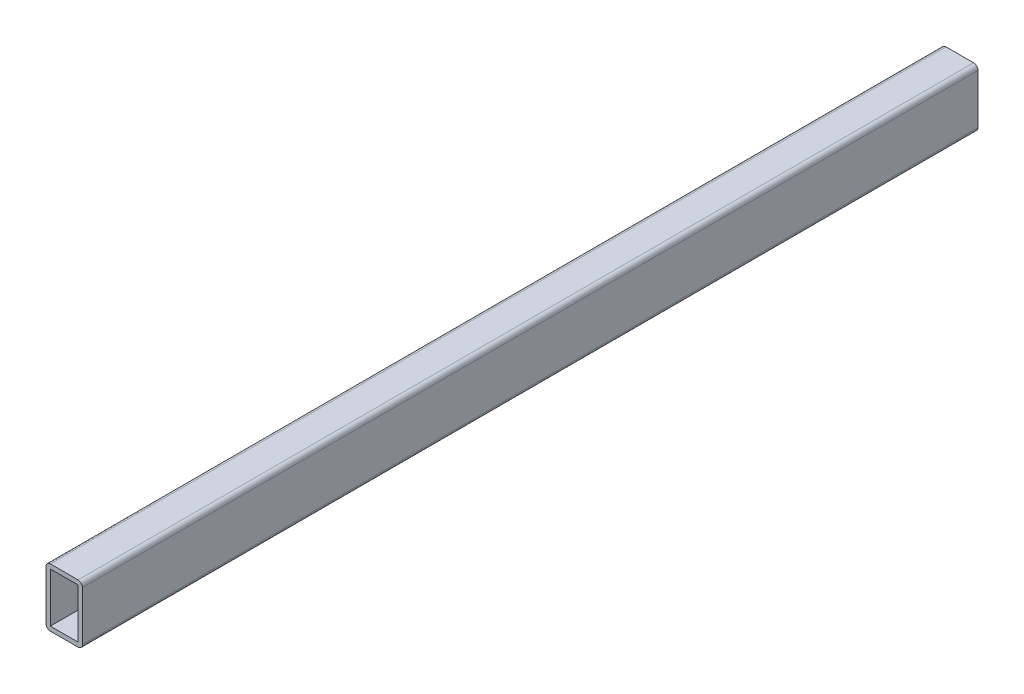
from build123d import *

# Parameters (mm, degrees)
SKETCH1_W           = 38
SKETCH1_H           = 68
BOSS_EXTRUDE1_DEPTH = 615


with BuildPart() as part:
    # Sketch1 → Boss-Extrude1 (new, symmetric)
    with BuildSketch(Plane.XY):
        with BuildLine():
            Line((19, -40), (-19, -40))
            ThreePointArc((-19, -40), (-23.242640687, -38.242640687), (-25, -34))
            Line((-25, -34), (-25, 34))
            ThreePointArc((-25, 34), (-23.242640687, 38.242640687), (-19, 40))
            Line((-19, 40), (19, 40))
            ThreePointArc((19, 40), (23.242640687, 38.242640687), (25, 34))
            Line((25, 34), (25, -34))
            ThreePointArc((25, -34), (23.242640687, -38.242640687), (19, -40))
        make_face()
        Rectangle(SKETCH1_W, SKETCH1_H, mode=Mode.SUBTRACT)
    extrude(amount=BOSS_EXTRUDE1_DEPTH, both=True)


solid = part.part
